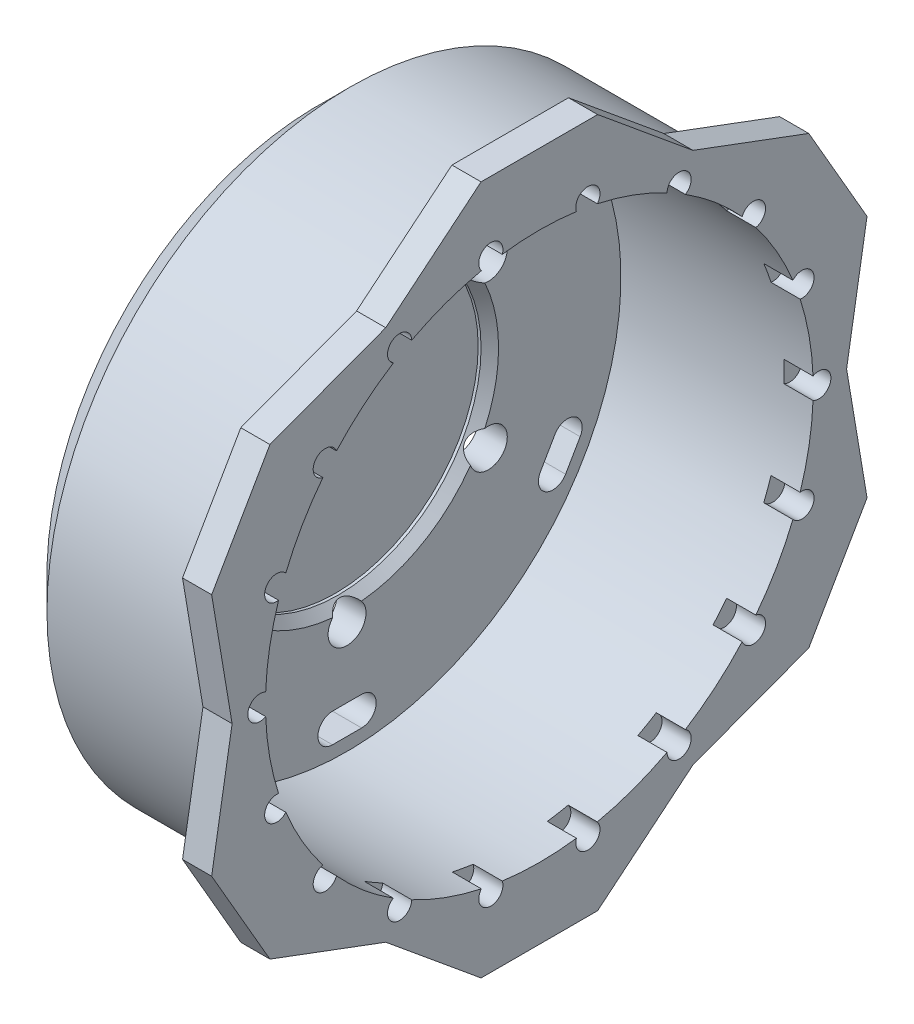
from build123d import *

# Parameters (mm, degrees)
SKETCH2_R           = 2.05
CUT_EXTRUDE1_DEPTH  = 10
SKETCH5_R           = 24.5
CUT_EXTRUDE4_DEPTH  = 2
BOSS_EXTRUDE1_DEPTH = 5
CIRPATTERN2_COUNT   = 6
CHAMFER2_SIZE       = 5.5
CHAMFER3_SIZE       = 1.5
SKETCH9_R           = 15
BOSS_EXTRUDE2_DEPTH = 7
CHAMFER4_SIZE       = 1
CUT_EXTRUDE7_START  = -5
CUT_EXTRUDE7_DEPTH  = 5
SKETCH12_R          = 3.25
CUT_EXTRUDE8_DEPTH  = 5


with BuildPart() as part:
    # Sketch1 → Revolve1 (revolve)
    with BuildSketch(Plane.XY, mode=Mode.PRIVATE) as revolve1_sk:
        Polygon((-5, 0), (-5, 52), (33, 52), (33, 47), (0, 47), (0, 0), align=None)
    revolve(revolve1_sk.sketch.rotate(Axis((-58.663171691, 0, 0), (1, 0, 0)), 90), axis=Axis((-58.663171691, 0, 0), (1, 0, 0)))

    # Sketch2 → Cut-Extrude1 (cut)
    with BuildSketch(Plane(origin=(0, 0, 0), x_dir=(0, 0, -1), z_dir=(1, 0, 0))):
        with Locations((0, 28)):
            Circle(SKETCH2_R)
        with Locations((24.248711306, 14)):
            Circle(SKETCH2_R)
        with Locations((24.248711306, -14)):
            Circle(SKETCH2_R)
        with Locations((0, -28)):
            Circle(SKETCH2_R)
        with Locations((-24.248711306, -14)):
            Circle(SKETCH2_R)
        with Locations((-24.248711306, 14)):
            Circle(SKETCH2_R)
        with BuildLine():
            Line((-2.5, 44.75), (2.5, 44.75))
            ThreePointArc((2.5, 44.75), (5, 42.25), (2.5, 39.75))
            Line((2.5, 39.75), (-2.5, 39.75))
            ThreePointArc((-2.5, 39.75), (-5, 42.25), (-2.5, 44.75))
        make_face()
    cut_extrude1 = extrude(amount=-CUT_EXTRUDE1_DEPTH, mode=Mode.SUBTRACT)

    # Sketch5 → Cut-Extrude4 (cut)
    with BuildSketch(Plane(origin=(0, 0, 0), x_dir=(0, 0, -1), z_dir=(1, 0, 0))):
        Circle(SKETCH5_R)
    extrude(amount=-CUT_EXTRUDE4_DEPTH, mode=Mode.SUBTRACT)

    # Sketch6 → Boss-Extrude1 (add)
    with BuildSketch(Plane(origin=(33, 0, 0), x_dir=(0, 0, -1), z_dir=(1, 0, 0))):
        Polygon((-10, 59.160797831), (-26.363112951, 45.662251077), (-46.23475383, 38.240652953), (-56.23475383, 20.920144878), (-52.726225902, 0), (-56.23475383, -20.920144878), (-46.23475383, -38.240652953), (-26.363112951, -45.662251077), (-10, -59.160797831), (10, -59.160797831), (26.363112951, -45.662251077), (46.23475383, -38.240652953), (56.23475383, -20.920144878), (52.726225902, 0), (56.23475383, 20.920144878), (46.23475383, 38.240652953), (26.363112951, 45.662251077), (10, 59.160797831), align=None)
        with BuildLine():
            ThreePointArc((-51.283776788, 8.600827774), (-45.033320997, 26), (-33.09042374, 40.112639613))
            ThreePointArc((-33.09042374, 40.112639613), (-26, 45.033320997), (-18.193353048, 48.713467387))
            ThreePointArc((-18.193353048, 48.713467387), (0, 52), (18.193353048, 48.713467387))
            ThreePointArc((18.193353048, 48.713467387), (26, 45.033320997), (33.09042374, 40.112639613))
            ThreePointArc((33.09042374, 40.112639613), (45.033320997, 26), (51.283776788, 8.600827774))
            ThreePointArc((51.283776788, 8.600827774), (51.820634852, 4.315298776), (52, 0))
            ThreePointArc((52, 0), (51.820634852, -4.315298776), (51.283776788, -8.600827774))
            ThreePointArc((51.283776788, -8.600827774), (45.033320997, -26), (33.09042374, -40.112639613))
            ThreePointArc((33.09042374, -40.112639613), (26, -45.033320997), (18.193353048, -48.713467387))
            ThreePointArc((18.193353048, -48.713467387), (0, -52), (-18.193353048, -48.713467387))
            ThreePointArc((-18.193353048, -48.713467387), (-26, -45.033320997), (-33.09042374, -40.112639613))
            ThreePointArc((-33.09042374, -40.112639613), (-45.033320997, -26), (-51.283776788, -8.600827774))
            ThreePointArc((-51.283776788, -8.600827774), (-52, 0), (-51.283776788, 8.600827774))
        make_face(mode=Mode.SUBTRACT)
    extrude(amount=-BOSS_EXTRUDE1_DEPTH)

    # CirPattern2: Cut-Extrude1 ×6 about axis
    cirpattern2_axis = Axis((0, 0, 0), (1, 0, 0))
    for i in range(1, CIRPATTERN2_COUNT):
        add(cut_extrude1.rotate(cirpattern2_axis, i * 360 / CIRPATTERN2_COUNT), mode=Mode.SUBTRACT)

    # Chamfer2
    chamfer2_edges = [part.edges().sort_by_distance(p)[0] for p in [
        (-5, 0, -52),
    ]]
    chamfer(chamfer2_edges, length=CHAMFER2_SIZE)

    # Chamfer3
    # the kernel refuses this chamfer: 1.5 mm, written as the material it takes off along each edge
    with BuildSketch(Plane(origin=(0, 0, 0), x_dir=(0, 0, -1), z_dir=(0, -1, 0))) as chamfer3_piece_1:
        Polygon((24.5 + CHAMFER3_SIZE, 0), (24.5, -CHAMFER3_SIZE), (24.5, 0), align=None)
    revolve(axis=Axis((0, 0, 0), (1, 0, 0)), mode=Mode.SUBTRACT)

    # Sketch9 → Boss-Extrude2 (add)
    with BuildSketch(Plane.ZY.offset(5)):
        with Locations(Location((0, 0, 0), (0, 0, 180))):
            Circle(SKETCH9_R)
    extrude(amount=BOSS_EXTRUDE2_DEPTH)

    # Chamfer4
    chamfer4_edges = [part.edges().sort_by_distance(p)[0] for p in [
        (-12, 0, 15),
    ]]
    chamfer(chamfer4_edges, length=CHAMFER4_SIZE)

    # Sketch11 → Cut-Extrude7 (cut)
    with BuildSketch(Plane(origin=(33, 0, 0), x_dir=(0, 0, -1), z_dir=(1, 0, 0)).offset(CUT_EXTRUDE7_START)):
        with BuildLine():
            ThreePointArc((-9.948403245, 45.935054946), (-8.16146435, 46.285964392), (-6.362272958, 46.567386472))
            ThreePointArc((-6.362272958, 46.567386472), (-8.68848657, 49.274855922), (-9.948403245, 45.935054946))
        make_face()
        with BuildLine():
            ThreePointArc((9.948403245, 45.935054946), (8.68848657, 49.274855922), (6.362272958, 46.567386472))
            ThreePointArc((6.362272958, 46.567386472), (8.16146435, 46.285964392), (9.948403245, 45.935054946))
        make_face()
        with BuildLine():
            ThreePointArc((25.059155194, 39.762277864), (25.0175, 43.331581078), (21.905565146, 41.583003928))
            ThreePointArc((21.905565146, 41.583003928), (23.5, 40.703193978), (25.059155194, 39.762277864))
        make_face()
        with BuildLine():
            ThreePointArc((37.147403193, 28.793583244), (38.329033711, 32.161878051), (34.806722885, 31.58309741))
            ThreePointArc((34.806722885, 31.58309741), (36.004088827, 30.211017655), (37.147403193, 28.793583244))
        make_face()
        with BuildLine():
            ThreePointArc((44.75512613, 14.351957536), (47.017520281, 17.112977871), (43.509676151, 17.773803228))
            ThreePointArc((43.509676151, 17.773803228), (44.165553177, 16.074946736), (44.75512613, 14.351957536))
        make_face()
        with BuildLine():
            ThreePointArc((46.96472034, -1.820726063), (50.035, 0), (46.96472034, 1.820726063))
            ThreePointArc((46.96472034, 1.820726063), (46.991179257, 0.910533917), (47, 0))
            ThreePointArc((47, 0), (46.991179257, -0.910533917), (46.96472034, -1.820726063))
        make_face()
        with BuildLine():
            ThreePointArc((43.509676151, -17.773803228), (47.017520281, -17.112977871), (44.75512613, -14.351957536))
            ThreePointArc((44.75512613, -14.351957536), (44.165553177, -16.074946736), (43.509676151, -17.773803228))
        make_face()
        with BuildLine():
            ThreePointArc((34.806722885, -31.58309741), (38.329033711, -32.161878051), (37.147403193, -28.793583244))
            ThreePointArc((37.147403193, -28.793583244), (36.004088827, -30.211017655), (34.806722885, -31.58309741))
        make_face()
        with BuildLine():
            ThreePointArc((21.905565146, -41.583003928), (25.0175, -43.331581078), (25.059155194, -39.762277864))
            ThreePointArc((25.059155194, -39.762277864), (23.5, -40.703193978), (21.905565146, -41.583003928))
        make_face()
        with BuildLine():
            ThreePointArc((6.362272958, -46.567386472), (8.68848657, -49.274855922), (9.948403245, -45.935054946))
            ThreePointArc((9.948403245, -45.935054946), (8.16146435, -46.285964392), (6.362272958, -46.567386472))
        make_face()
        with BuildLine():
            ThreePointArc((-6.362272958, -46.567386472), (-8.16146435, -46.285964392), (-9.948403245, -45.935054946))
            ThreePointArc((-9.948403245, -45.935054946), (-8.68848657, -49.274855922), (-6.362272958, -46.567386472))
        make_face()
        with BuildLine():
            ThreePointArc((-21.905565146, -41.583003928), (-23.5, -40.703193978), (-25.059155194, -39.762277864))
            ThreePointArc((-25.059155194, -39.762277864), (-25.0175, -43.331581078), (-21.905565146, -41.583003928))
        make_face()
        with BuildLine():
            ThreePointArc((-34.806722885, -31.58309741), (-36.004088827, -30.211017655), (-37.147403193, -28.793583244))
            ThreePointArc((-37.147403193, -28.793583244), (-38.329033711, -32.161878051), (-34.806722885, -31.58309741))
        make_face()
        with BuildLine():
            ThreePointArc((-43.509676151, -17.773803228), (-44.165553177, -16.074946736), (-44.75512613, -14.351957536))
            ThreePointArc((-44.75512613, -14.351957536), (-47.017520281, -17.112977871), (-43.509676151, -17.773803228))
        make_face()
        with BuildLine():
            ThreePointArc((-46.96472034, -1.820726063), (-47, 0), (-46.96472034, 1.820726063))
            ThreePointArc((-46.96472034, 1.820726063), (-50.035, 0), (-46.96472034, -1.820726063))
        make_face()
        with BuildLine():
            ThreePointArc((-44.75512613, 14.351957536), (-44.165553177, 16.074946736), (-43.509676151, 17.773803228))
            ThreePointArc((-43.509676151, 17.773803228), (-47.017520281, 17.112977871), (-44.75512613, 14.351957536))
        make_face()
        with BuildLine():
            ThreePointArc((-37.147403193, 28.793583244), (-36.004088827, 30.211017655), (-34.806722885, 31.58309741))
            ThreePointArc((-34.806722885, 31.58309741), (-38.329033711, 32.161878051), (-37.147403193, 28.793583244))
        make_face()
        with BuildLine():
            ThreePointArc((-25.059155194, 39.762277864), (-23.5, 40.703193978), (-21.905565146, 41.583003928))
            ThreePointArc((-21.905565146, 41.583003928), (-25.0175, 43.331581078), (-25.059155194, 39.762277864))
        make_face()
    extrude(amount=CUT_EXTRUDE7_DEPTH, mode=Mode.SUBTRACT)

    # Sketch12 → Cut-Extrude8 (cut)
    with BuildSketch(Plane.ZY.offset(5)):
        with Locations((0, 28)):
            Circle(SKETCH12_R)
        with Locations((24.248711306, 14)):
            Circle(SKETCH12_R)
        with Locations((24.248711306, -14)):
            Circle(SKETCH12_R)
        with Locations((0, -28)):
            Circle(SKETCH12_R)
        with Locations((-24.248711306, -14)):
            Circle(SKETCH12_R)
        with Locations((-24.248711306, 14)):
            Circle(SKETCH12_R)
    extrude(amount=-CUT_EXTRUDE8_DEPTH, mode=Mode.SUBTRACT)


solid = part.part
